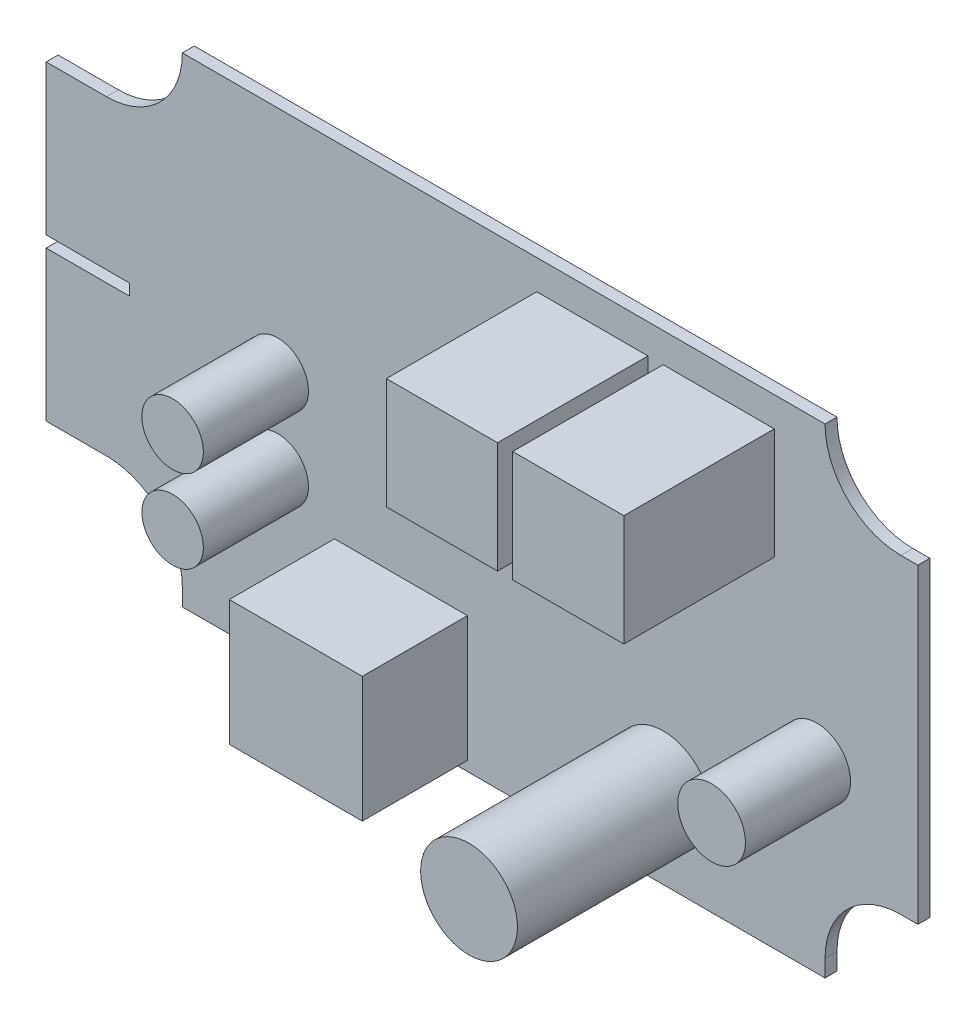
from build123d import *

# Parameters (mm, degrees)
BOSS_EXTRUDE1_DEPTH = 1.5748
SKETCH2_W           = 14.65
SKETCH2_H           = 14.65
BOSS_EXTRUDE2_DEPTH = 19.82
SKETCH3_R           = 6.38
BOSS_EXTRUDE3_DEPTH = 25.62
SKETCH4_R           = 4.05
SKETCH4_R_2         = 4.45846
SKETCH4_W           = 17.528842204
SKETCH4_H           = 16.527194078
BOSS_EXTRUDE4_DEPTH = 13.86


with BuildPart() as part:
    # Sketch1 → Boss-Extrude1 (new body)
    with BuildSketch(Plane.XY):
        with BuildLine():
            Line((42.354093023, -30.703264053), (42.354093023, -32.943264053))
            Line((42.354093023, -32.943264053), (-42.354093023, -32.943264053))
            Line((-42.354093023, -32.943264053), (-42.354093023, -30.703264053))
            ThreePointArc((-42.354093023, -30.703264053), (-45.283025211, -23.632196241), (-52.354093023, -20.703264053))
            Line((-52.354093023, -20.703264053), (-60.301272865, -20.703264053))
            Line((-60.301272865, -20.703264053), (-60.301272865, -0.953264053))
            Line((-60.301272865, -0.953264053), (-49.301272865, -0.953264053))
            Line((-49.301272865, -0.953264053), (-49.301272865, 0.546735947))
            Line((-49.301272865, 0.546735947), (-60.301272865, 0.546735947))
            Line((-60.301272865, 0.546735947), (-60.301272865, 20.296735947))
            Line((-60.301272865, 20.296735947), (-52.354093023, 20.296735947))
            ThreePointArc((-52.354093023, 20.296735947), (-45.283025211, 23.225668135), (-42.354093023, 30.296735947))
            Line((-42.354093023, 30.296735947), (42.354093023, 30.296735947))
            ThreePointArc((42.354093023, 30.296735947), (45.283025211, 23.225668135), (52.354093023, 20.296735947))
            Line((52.354093023, 20.296735947), (54.593335979, 20.296735947))
            Line((54.593335979, 20.296735947), (54.593335979, -20.703264053))
            Line((54.593335979, -20.703264053), (52.354093023, -20.703264053))
            ThreePointArc((52.354093023, -20.703264053), (45.283025211, -23.632196241), (42.354093023, -30.703264053))
        make_face()
    extrude(amount=BOSS_EXTRUDE1_DEPTH)

    # Sketch2 → Boss-Extrude2 (add)
    with BuildSketch(Plane.XY.offset(1.5748)):
        with Locations((11.686894588, 19.066351865)):
            Rectangle(SKETCH2_W, SKETCH2_H)
        with Locations((28.336894588, 19.066351865)):
            Rectangle(SKETCH2_W, SKETCH2_H)
    extrude(amount=BOSS_EXTRUDE2_DEPTH)

    # Sketch3 → Boss-Extrude3 (add)
    with BuildSketch(Plane.XY.offset(1.5748)):
        with Locations((21.050882576, -21.779136192)):
            Circle(SKETCH3_R)
    extrude(amount=BOSS_EXTRUDE3_DEPTH)

    # Sketch4 → Boss-Extrude4 (add)
    with BuildSketch(Plane.XY.offset(1.5748)):
        with Locations((-29.775377187, 0)):
            Circle(SKETCH4_R)
        with Locations((-29.775377187, -10.91000664)):
            Circle(SKETCH4_R)
        with Locations((41.26131402, -8.841126254)):
            Circle(SKETCH4_R_2)
        with Locations((-13.538274313, -23.407391016)):
            Rectangle(SKETCH4_W, SKETCH4_H)
    extrude(amount=BOSS_EXTRUDE4_DEPTH)


solid = part.part
